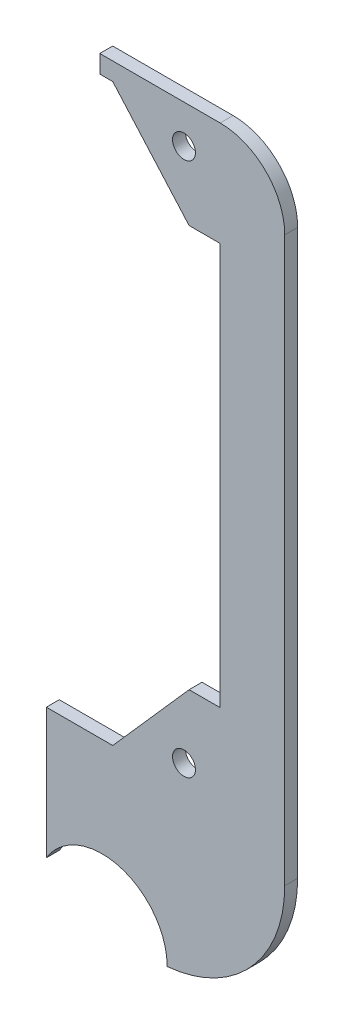
from build123d import *

# Parameters (mm, degrees)
SKETCH1_R           = 2.25
BOSS_EXTRUDE1_DEPTH = 2.54
FILLET2_R           = 12.7
FILLET1_R           = 25.4


with BuildPart() as part:
    # Sketch1 → Boss-Extrude1 (new body)
    with BuildSketch(Plane.XY):
        with BuildLine():
            Line((-15.551371247, -28.902434831), (0, -28.902434831))
            Line((0, -28.902434831), (7.55250204, -28.902434831))
            Line((7.55250204, -28.902434831), (7.55250204, 119.888))
            Line((7.55250204, 119.888), (0, 119.888))
            Line((0, 119.888), (-28.801319167, 119.888))
            Line((-28.801319167, 119.888), (-28.801319167, 116.374908255))
            Line((-28.801319167, 116.374908255), (-26.247498299, 116.374908255))
            Line((-26.247498299, 116.374908255), (-11.247498299, 99.374908255))
            Line((-11.247498299, 99.374908255), (-5.147498299, 99.374908255))
            Line((-5.147498299, 99.374908255), (-5.147498299, 20.374908255))
            Line((-5.147498299, 20.374908255), (-11.247498299, 20.374908255))
            Line((-11.247498299, 20.374908255), (-26.247498299, 3.374908255))
            Line((-26.247498299, 3.374908255), (-39.300222509, 3.374908255))
            Line((-39.300222509, 3.374908255), (-39.300222509, -22.265655957))
            ThreePointArc((-39.300222509, -22.265655957), (-24.907613028, -16.573051533), (-15.551371247, -28.902434831))
        make_face()
        with Locations((-12.247498299, 112.374908255)):
            Circle(SKETCH1_R, mode=Mode.SUBTRACT)
        with Locations((-12.247498299, 7.374908255)):
            Circle(SKETCH1_R, mode=Mode.SUBTRACT)
    extrude(amount=BOSS_EXTRUDE1_DEPTH)

    # Fillet2
    fillet2_edges = [part.edges().sort_by_distance(p)[0] for p in [
        (7.55250204, 119.888, 1.27),
    ]]
    fillet(fillet2_edges, radius=FILLET2_R)

    # Fillet1
    # the kernel refuses this fillet: 25.4 mm, written as the material it takes off along each edge
    with BuildSketch(Plane(origin=(7.55250204, -28.902434831, -63.240009197), x_dir=(0, 1, 0), z_dir=(0, 0, 1))) as fillet1_piece_1:
        with BuildLine():
            CenterArc((25.296003679, 25.4), FILLET1_R, 185.186543812, 84.813456188)
            Line((0, 23.103873287), (-0.505920074, 23.057950753))
            ThreePointArc((-0.505920074, 23.057950753), (-0.508, 11.551936644), (-0.508, 0))
            Line((-0.508, 0), (0, -0.508))
            Line((0, -0.508), (25.296003679, -0.508))
            Line((25.296003679, -0.508), (25.296003679, 0))
        make_face()
    extrude(amount=129.020018394, mode=Mode.SUBTRACT)


solid = part.part
